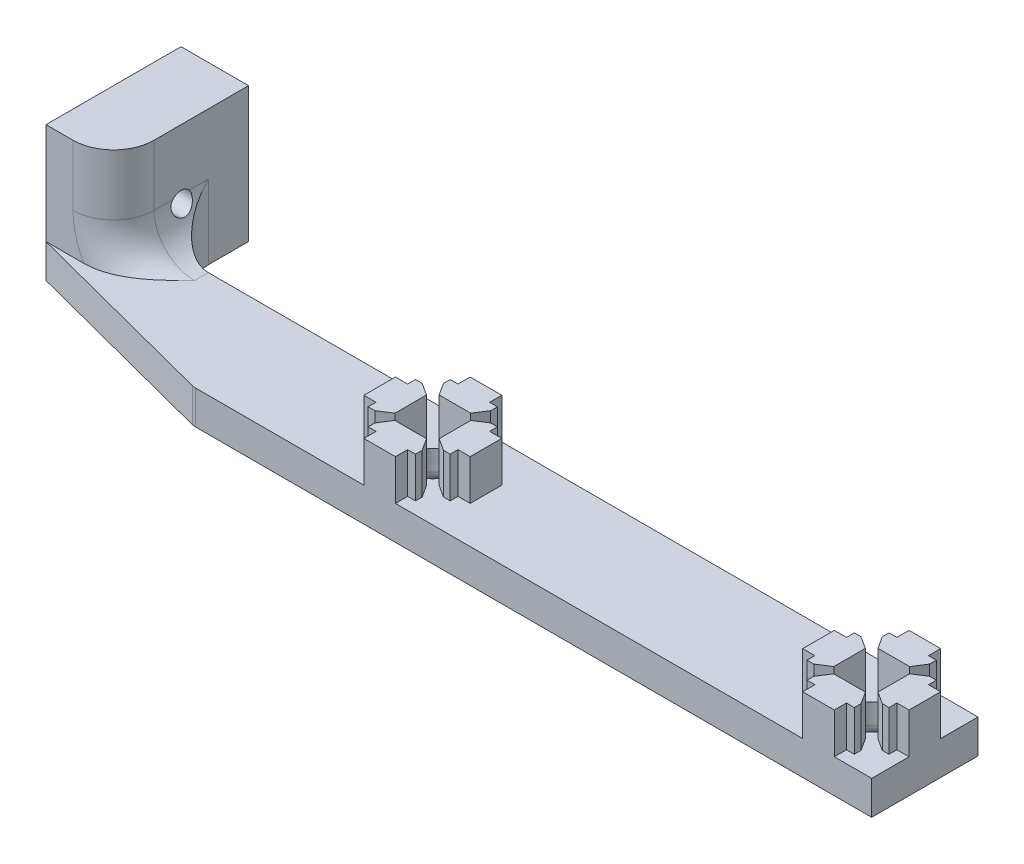
from build123d import *

# Parameters (mm, degrees)
BOSS_EXTRUDE1_DEPTH   = 7.62
BOSS_EXTRUDE1_2_DEPTH = 7.62
BOSS_EXTRUDE1_3_DEPTH = 7.62
BOSS_EXTRUDE1_4_DEPTH = 7.62
SKETCH2_W             = 165.1
SKETCH2_H             = 20
BOSS_EXTRUDE2_DEPTH   = 6.35
LPATTERN2_COUNT       = 2
LPATTERN2_PITCH       = 82.55
CUT_EXTRUDE1_DEPTH    = 157.048617104
FILLET1_R             = 2.54
SKETCH6_W             = 25.4
SKETCH6_H             = 25.4
BOSS_EXTRUDE7_DEPTH   = 12.7
FILLET3_R             = 7.62
FILLET5_R             = 7.62
SKETCH11_R            = 1.984375
CUT_EXTRUDE3_DEPTH    = 169.09345118
SKETCH13_R            = 3.5
CUT_EXTRUDE5_DEPTH    = 159.282684864
FILLET6_R             = 2.54


with BuildPart() as part:
    # Sketch1 → Boss-Extrude1 (new body)
    with BuildSketch(Plane(origin=(0, 0, 0), x_dir=(1, 0, 0), z_dir=(0, 1, 0))):
        Polygon((-2.9718, 10), (-2.9718, 7.714), (-4.4450054, 7.714), (-4.4450054, 6.444), (-2.9718, 4.158), (2.9718, 4.158), (4.4449946, 6.444), (4.4449946, 7.714), (2.9718, 7.714), (2.9718, 10), align=None)
    boss_extrude1 = extrude(amount=BOSS_EXTRUDE1_DEPTH)



with BuildPart() as body_2:
    # Sketch1 → Boss-Extrude1 2 (new body)
    with BuildSketch(Plane(origin=(0, 0, 0), x_dir=(1, 0, 0), z_dir=(0, 1, 0))):
        Polygon((4.158, -2.9718), (4.158, 2.9718), (6.444, 4.4449946), (7.714, 4.4449946), (7.714, 2.9718), (10, 2.9718), (10, -2.9718), (7.714, -2.9718), (7.714, -4.4450054), (6.444, -4.4450054), align=None)
    boss_extrude1_2 = extrude(amount=BOSS_EXTRUDE1_2_DEPTH)


with BuildPart() as body_3:
    # Sketch1 → Boss-Extrude1 3 (new body)
    with BuildSketch(Plane(origin=(0, 0, 0), x_dir=(1, 0, 0), z_dir=(0, 1, 0))):
        Polygon((4.4450054, -6.444), (2.9718, -4.158), (-2.9718, -4.158), (-4.4449946, -6.444), (-4.4449946, -7.714), (-2.9718, -7.714), (-2.9718, -10), (2.9718, -10), (2.9718, -7.714), (4.4450054, -7.714), align=None)
    boss_extrude1_3 = extrude(amount=BOSS_EXTRUDE1_3_DEPTH)


with BuildPart() as body_4:
    # Sketch1 → Boss-Extrude1 4 (new body)
    with BuildSketch(Plane(origin=(0, 0, 0), x_dir=(1, 0, 0), z_dir=(0, 1, 0))):
        Polygon((-10, -2.9718), (-10, 2.9718), (-7.714, 2.9718), (-7.714, 4.4450054), (-6.444, 4.4450054), (-4.158, 2.9718), (-4.158, -2.9718), (-6.444, -4.4449946), (-7.714, -4.4449946), (-7.714, -2.9718), align=None)
    boss_extrude1_4 = extrude(amount=BOSS_EXTRUDE1_4_DEPTH)


with BuildPart() as part_1:
    add(part.part)

    add(body_2.part)  # Boss-Extrude2 merges body 2

    add(body_3.part)  # Boss-Extrude2 merges body 3

    add(body_4.part)  # Boss-Extrude2 merges body 4
    # Sketch2 → Boss-Extrude2 (add)
    with BuildSketch(Plane.XZ):
        with Locations((-72.55, 0)):
            Rectangle(SKETCH2_W, SKETCH2_H)
    extrude(amount=BOSS_EXTRUDE2_DEPTH)

    # LPattern2: Boss-Extrude1, Boss-Extrude1 2, Boss-Extrude1 3, Boss-Extrude1 4 ×2
    with Locations(*[(-i * LPATTERN2_PITCH, 0, 0) for i in range(1, LPATTERN2_COUNT)]):
        add(boss_extrude1)
        add(boss_extrude1_2)
        add(boss_extrude1_3)
        add(boss_extrude1_4)

    # Sketch4 → Cut-Extrude1 (cut, through all)
    with BuildSketch(Plane(origin=(0, -6.35, 0), x_dir=(-1, 0, 0), z_dir=(0, -1, 0))):
        Polygon((155.1, -10), (117.5588, -10), (155.1, -0.2108), align=None)
    extrude(amount=-CUT_EXTRUDE1_DEPTH, mode=Mode.SUBTRACT)

    # Fillet1
    fillet1_edges = [part_1.edges().sort_by_distance(p)[0] for p in [
        (-117.5588, -3.175, 10),
    ]]
    fillet(fillet1_edges, radius=FILLET1_R)

    # Sketch6 → Boss-Extrude7 (add)
    with BuildSketch(Plane.ZY.offset(155.1)):
        with Locations((-12.4892, 6.35)):
            Rectangle(SKETCH6_W, SKETCH6_H)
    extrude(amount=-BOSS_EXTRUDE7_DEPTH)

    # Fillet3
    fillet3_edges = [part_1.edges().sort_by_distance(p)[0] for p in [
        (-142.4, 0, -4.8946),
        (-142.4, -3.175, -10),
    ]]
    fillet(fillet3_edges, radius=FILLET3_R)

    # Fillet5
    # the kernel refuses this fillet: 7.62 mm, written as the material it takes off along each edge
    with BuildSketch(Plane(origin=(-142.4, 38.1, 0.2108), x_dir=(-1, 0, 0), z_dir=(0, -1, 0))) as fillet5_piece_1:
        with BuildLine():
            CenterArc((FILLET5_R, FILLET5_R), FILLET5_R, 180, 90)
            Line((0, FILLET5_R), (0, 0))
            Line((0, 0), (FILLET5_R, 0))
        make_face()
    extrude(amount=30.48, mode=Mode.SUBTRACT)
    with BuildSketch(Plane(origin=(-134.78, 7.62, 0.2108), x_dir=(0.5976672776328269, 0.8017442392976487, 0), z_dir=(-0.8017442392976487, 0.5976672776328269, 0))) as fillet5_piece_2_section:
        with BuildLine():
            CenterArc((7.62 + FILLET5_R, FILLET5_R), FILLET5_R, 180, 90)
            Line((7.62, FILLET5_R), (7.62, 0))
            Line((7.62, 0), (7.62 + FILLET5_R, 0))
        make_face()
    fillet5_piece_2 = revolve(axis=Axis((-134.78, 7.62, 0.2108), (0, 0, -1)), revolution_arc=233.296989237, mode=Mode.PRIVATE)
    fillet5_piece_2 = split(fillet5_piece_2, bisect_by=Plane(origin=(-140.494534821, 0, -2.163807691), z_dir=(0, 1, 0)), keep=Keep.TOP, mode=Mode.PRIVATE)
    add(fillet5_piece_2, mode=Mode.SUBTRACT)

    # Sketch11 → Cut-Extrude3 (cut, through all)
    with BuildSketch(Plane.ZY.offset(155.1)):
        with Locations((-12.4892, 6.35)):
            Circle(SKETCH11_R)
    extrude(amount=-CUT_EXTRUDE3_DEPTH, mode=Mode.SUBTRACT)

    # Sketch13 → Cut-Extrude5 (cut, through all)
    with BuildSketch(Plane(origin=(0, 0, 0), x_dir=(1, 0, 0), z_dir=(0, 1, 0))):
        with Locations(Location((0, 0, 0), (0, 0, 270))):
            Circle(SKETCH13_R)
        with Locations(Location((-82.55, 0, 0), (0, 0, 270))):
            Circle(SKETCH13_R)
    extrude(amount=-CUT_EXTRUDE5_DEPTH, mode=Mode.SUBTRACT)

    # Fillet6
    fillet6_edges = [part_1.edges().sort_by_distance(p)[0] for p in [
        (0, -6.35, -3.5),
        (-82.55, -6.35, -3.5),
    ]]
    fillet(fillet6_edges, radius=FILLET6_R)


solid = part_1.part
